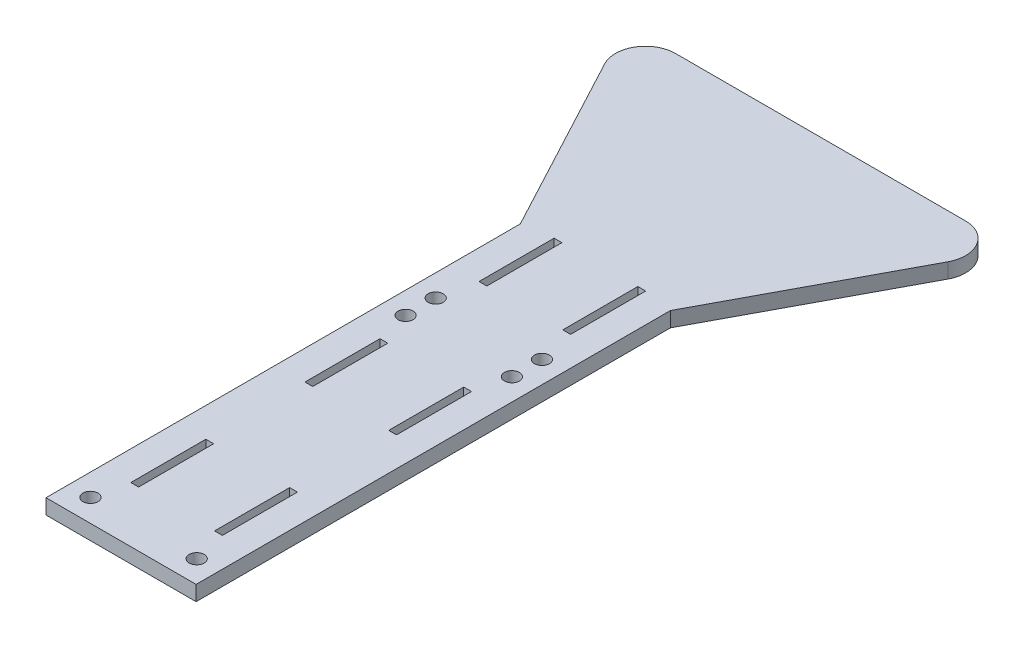
from build123d import *

# Parameters (mm, degrees)
BOSS_EXTRUDE1_DEPTH = 6.35
SKETCH2_W           = 3.302
SKETCH2_H           = 31.75
CUT_EXTRUDE1_DEPTH  = 308.274393824
SKETCH3_R           = 3.175
CUT_EXTRUDE2_DEPTH  = 308.274393824
FILLET1_R           = 12.7


with BuildPart() as part:
    # Sketch1 → Boss-Extrude1 (new body)
    with BuildSketch(Plane(origin=(0, 0, 0), x_dir=(1, 0, 0), z_dir=(0, 1, 0))):
        Polygon((-31.75, 0), (31.75, 0), (31.75, 200.66), (82.55, 295.91), (-82.55, 295.91), (-31.75, 200.66), align=None)
    extrude(amount=BOSS_EXTRUDE1_DEPTH)

    # Sketch2 → Cut-Extrude1 (cut, through all)
    with BuildSketch(Plane(origin=(0, 6.35, 0), x_dir=(1, 0, 0), z_dir=(0, 1, 0))):
        with Locations((-17.7165, 39.37)):
            Rectangle(SKETCH2_W, SKETCH2_H)
        with Locations((-17.7165, 113.03)):
            Rectangle(SKETCH2_W, SKETCH2_H)
        with Locations((-17.7165, 186.69)):
            Rectangle(SKETCH2_W, SKETCH2_H)
        with Locations((17.7165, 39.37)):
            Rectangle(SKETCH2_W, SKETCH2_H)
        with Locations((17.7165, 113.03)):
            Rectangle(SKETCH2_W, SKETCH2_H)
        with Locations((17.7165, 186.69)):
            Rectangle(SKETCH2_W, SKETCH2_H)
    extrude(amount=-CUT_EXTRUDE1_DEPTH, mode=Mode.SUBTRACT)

    # Sketch3 → Cut-Extrude2 (cut, through all)
    with BuildSketch(Plane(origin=(0, 6.35, 0), x_dir=(1, 0, 0), z_dir=(0, 1, 0))):
        with Locations((-22.479, 155.575)):
            Circle(SKETCH3_R)
        with Locations((-22.479, 142.875)):
            Circle(SKETCH3_R)
        with Locations((22.479, 142.875)):
            Circle(SKETCH3_R)
        with Locations((22.479, 155.575)):
            Circle(SKETCH3_R)
        with Locations((-22.479, 9.525)):
            Circle(SKETCH3_R)
        with Locations((22.479, 9.525)):
            Circle(SKETCH3_R)
    extrude(amount=-CUT_EXTRUDE2_DEPTH, mode=Mode.SUBTRACT)

    # Fillet1
    fillet1_edges = [part.edges().sort_by_distance(p)[0] for p in [
        (82.55, 3.175, -295.91),
        (-82.55, 3.175, -295.91),
    ]]
    fillet(fillet1_edges, radius=FILLET1_R)


solid = part.part
